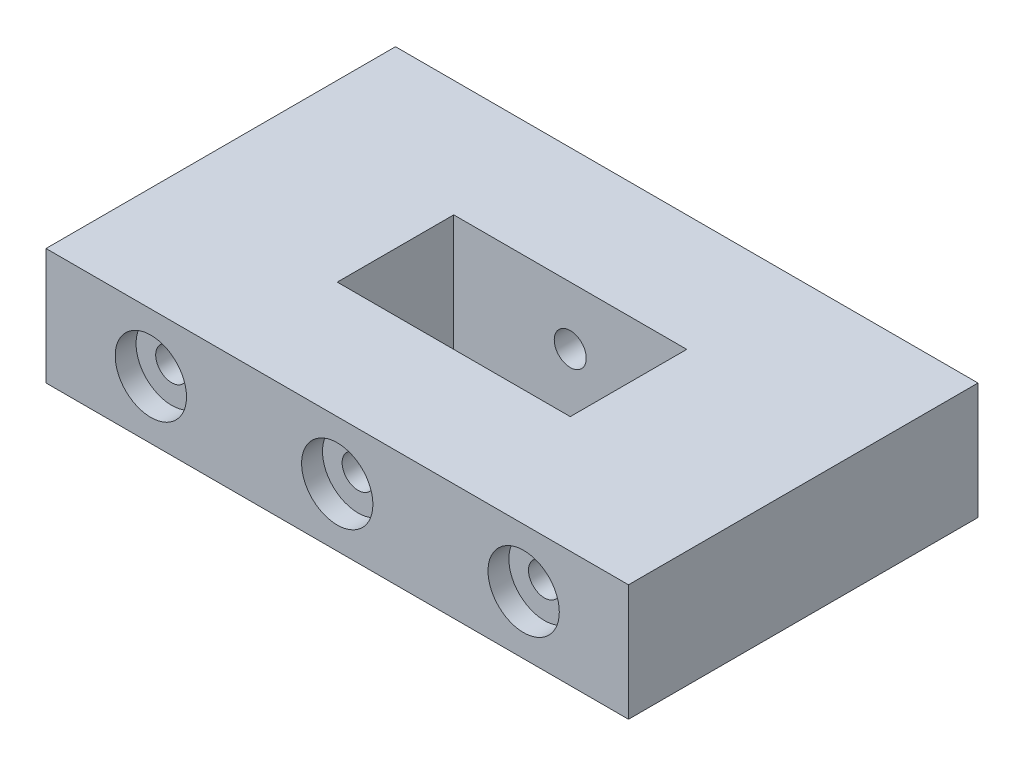
from build123d import *
from build123d.topology import SkipClean

# Parameters (mm, degrees)
SKETCH1_W                               = 100
SKETCH1_H                               = 60
BOSS_EXTRUDE1_DEPTH                     = 20
SKETCH2_W                               = 40
SKETCH2_H                               = 20
CUT_EXTRUDE1_DEPTH                      = 62.64414003
CBORE_FOR_M5_HEX_HEAD_BOLT1_D           = 5.5
CBORE_FOR_M5_HEX_HEAD_BOLT1_DEPTH       = 15
CBORE_FOR_M5_HEX_HEAD_BOLT1_CBORE_D     = 12.24
CBORE_FOR_M5_HEX_HEAD_BOLT1_CBORE_DEPTH = 3.58
CBORE_FOR_M5_HEX_HEAD_BOLT1_TIP         = 1.652366702
CBORE_FOR_M5_HEX_HEAD_BOLT2_D           = 5.5
CBORE_FOR_M5_HEX_HEAD_BOLT2_DEPTH       = 20
CBORE_FOR_M5_HEX_HEAD_BOLT2_CBORE_D     = 12.24
CBORE_FOR_M5_HEX_HEAD_BOLT2_CBORE_DEPTH = 3.58
CBORE_FOR_M5_HEX_HEAD_BOLT2_TIP         = 1.652366702
SHELL1_START                            = -48.6
SHELL1_2_OUTLINE_W                      = 17.2
SHELL1_2_OUTLINE_H                      = 17.2
SHELL1_2_DEPTH                          = 97.2
SHELL1_3_OUTLINE_W                      = 17.2
SHELL1_3_OUTLINE_H                      = 22.8
SHELL1_3_DEPTH                          = 27.2
SHELL1_START_2                          = 21.4
SHELL1_4_OUTLINE_W                      = 17.2
SHELL1_4_OUTLINE_H                      = 22.8
SHELL1_4_DEPTH                          = 27.2
SHELL1_START_3                          = -28.6
SHELL1_5_OUTLINE_R                      = 7.52
SHELL1_5_OUTLINE_R_2                    = 6.12
SHELL1_5_DEPTH                          = 3.58
SHELL1_START_4                          = -26.42
SHELL1_6_OUTLINE_R                      = 4.15
SHELL1_6_OUTLINE_R_2                    = 2.75
SHELL1_6_DEPTH                          = 15.02
SHELL1_7_OUTLINE_R                      = 6.12
SHELL1_7_OUTLINE_R_2                    = 4.15
SHELL1_7_DEPTH                          = 1.4


with BuildPart() as part:
    # Sketch1 → Boss-Extrude1 (new body)
    with BuildSketch(Plane(origin=(0, 0, 0), x_dir=(1, 0, 0), z_dir=(0, 1, 0))):
        Rectangle(SKETCH1_W, SKETCH1_H)
    extrude(amount=BOSS_EXTRUDE1_DEPTH)

    # Sketch2 → Cut-Extrude1 (cut, through all)
    with BuildSketch(Plane(origin=(0, 20, 0), x_dir=(1, 0, 0), z_dir=(0, 1, 0))):
        Rectangle(SKETCH2_W, SKETCH2_H)
    extrude(amount=-CUT_EXTRUDE1_DEPTH, mode=Mode.SUBTRACT)

    # CBORE for M5 Hex Head Bolt1
    with Locations(Plane.XY.offset(30)):
        with Locations((0, 10), (-32, 10), (32, 10)):
            CounterBoreHole(CBORE_FOR_M5_HEX_HEAD_BOLT1_D / 2, CBORE_FOR_M5_HEX_HEAD_BOLT1_CBORE_D / 2, CBORE_FOR_M5_HEX_HEAD_BOLT1_CBORE_DEPTH, depth=CBORE_FOR_M5_HEX_HEAD_BOLT1_DEPTH)
            with Locations((0, 0, -(CBORE_FOR_M5_HEX_HEAD_BOLT1_DEPTH + CBORE_FOR_M5_HEX_HEAD_BOLT1_TIP / 2))):  # 118° drill point
                Cone(0, CBORE_FOR_M5_HEX_HEAD_BOLT1_D / 2, CBORE_FOR_M5_HEX_HEAD_BOLT1_TIP, mode=Mode.SUBTRACT)

    # CBORE for M5 Hex Head Bolt2
    with Locations(Plane(origin=(0, 0, -30), x_dir=(-1, 0, 0), z_dir=(0, 0, -1))):
        with Locations((0, 10.04768743), (-31.999964467, 10), (31.999964467, 10)):
            CounterBoreHole(CBORE_FOR_M5_HEX_HEAD_BOLT2_D / 2, CBORE_FOR_M5_HEX_HEAD_BOLT2_CBORE_D / 2, CBORE_FOR_M5_HEX_HEAD_BOLT2_CBORE_DEPTH, depth=CBORE_FOR_M5_HEX_HEAD_BOLT2_DEPTH)
            with Locations((0, 0, -(CBORE_FOR_M5_HEX_HEAD_BOLT2_DEPTH + CBORE_FOR_M5_HEX_HEAD_BOLT2_TIP / 2))):  # 118° drill point
                Cone(0, CBORE_FOR_M5_HEX_HEAD_BOLT2_D / 2, CBORE_FOR_M5_HEX_HEAD_BOLT2_TIP, mode=Mode.SUBTRACT)

    # Shell1: read off the stored shape, not the designer's step
    # Shell1 outline → Shell1 (revolve, cut)
    with BuildSketch(Plane(origin=(-32, 10, 0), x_dir=(1, 0, 0), z_dir=(0, -1, 0))):
        Polygon((4.15, 14.207918111), (0, 11.714346542), (7.52, 11.714346542), (7.52, 25.02), (4.15, 25.02), align=None)
    revolve(axis=Axis((-32, 10, 0), (0, 0, 1)), mode=Mode.SUBTRACT)

    # Shell1 2 outline → Shell1 2 (cut)
    with BuildSketch(Plane.YZ.offset(SHELL1_START)):
        with Locations((10, -20)):
            Rectangle(SHELL1_2_OUTLINE_W, SHELL1_2_OUTLINE_H)
        with Locations((10, 20)):
            Rectangle(SHELL1_2_OUTLINE_W, SHELL1_2_OUTLINE_H)
    extrude(amount=SHELL1_2_DEPTH, mode=Mode.SUBTRACT)

    # Shell1 3 outline → Shell1 3 (cut)
    with BuildSketch(Plane.YZ.offset(SHELL1_START)):
        with Locations((10, 0)):
            Rectangle(SHELL1_3_OUTLINE_W, SHELL1_3_OUTLINE_H)
    extrude(amount=SHELL1_3_DEPTH, mode=Mode.SUBTRACT)

    # Shell1 4 outline → Shell1 4 (cut)
    with BuildSketch(Plane.YZ.offset(SHELL1_START_2)):
        with Locations((10, 0)):
            Rectangle(SHELL1_4_OUTLINE_W, SHELL1_4_OUTLINE_H)
    extrude(amount=SHELL1_4_DEPTH, mode=Mode.SUBTRACT)

    # Shell1 5 outline → Shell1 5 (add)
    # profile 1 of 3: a face of its own
    with SkipClean():  # the faces are left unmerged after this step: merging them gives an invalid solid
        with BuildSketch(Plane.XY.offset(SHELL1_START_3)):
            with Locations((0, 10.04768743)):
                Circle(SHELL1_5_OUTLINE_R)
            with Locations((0, 10.04768743)):
                Circle(SHELL1_5_OUTLINE_R_2, mode=Mode.SUBTRACT)
        # profile 2 of 3: a face of its own
        with BuildSketch(Plane.XY.offset(SHELL1_START_3)):
            with Locations((-31.999964467, 10)):
                Circle(SHELL1_5_OUTLINE_R)
            with Locations((-31.999964467, 10)):
                Circle(SHELL1_5_OUTLINE_R_2, mode=Mode.SUBTRACT)
        # profile 3 of 3: a face of its own
        with BuildSketch(Plane.XY.offset(SHELL1_START_3)):
            with Locations((31.999964467, 10)):
                Circle(SHELL1_5_OUTLINE_R)
            with Locations((31.999964467, 10)):
                Circle(SHELL1_5_OUTLINE_R_2, mode=Mode.SUBTRACT)
        extrude(amount=SHELL1_5_DEPTH)
    add(part.part.scale(1), mode=Mode.REPLACE)  # the faces are merged on a copy

    # Shell1 6 outline → Shell1 6 (add)
    with BuildSketch(Plane.XY.offset(SHELL1_START_4)):
        with Locations((0, 10.04768743)):
            Circle(SHELL1_6_OUTLINE_R)
        with Locations((0, 10.04768743)):
            Circle(SHELL1_6_OUTLINE_R_2, mode=Mode.SUBTRACT)
    extrude(amount=SHELL1_6_DEPTH)

    # Shell1 7 outline → Shell1 7 (add)
    with SkipClean():  # the faces are left unmerged after this step: merging them gives an invalid solid
        with BuildSketch(Plane.XY.offset(SHELL1_START_4)):
            with Locations((0, 10.04768743)):
                Circle(SHELL1_7_OUTLINE_R)
            with Locations((0, 10.04768743)):
                Circle(SHELL1_7_OUTLINE_R_2, mode=Mode.SUBTRACT)
        extrude(amount=SHELL1_7_DEPTH)

    # Shell1 8 outline → Shell1 8 (revolve)
    with SkipClean():  # the faces are left unmerged after this step: merging them gives an invalid solid
        with BuildSketch(Plane(origin=(32, 10, 0), x_dir=(1, 0, 0), z_dir=(0, -1, 0))):
            Polygon((0, 11.714346542), (4.15, 14.207918111), (4.15, 25.02), (7.52, 25.02), (7.52, 28.6), (6.12, 28.6), (6.12, 26.42), (2.75, 26.42), (2.75, 15), (0, 13.347633298), align=None)
        revolve(axis=Axis((32, 10, 0), (0, 0, 1)))

    # Shell1 9 outline → Shell1 9 (revolve)
    with SkipClean():  # the faces are left unmerged after this step: merging them gives an invalid solid
        with BuildSketch(Plane(origin=(-32, 10, 0), x_dir=(1, 0, 0), z_dir=(0, -1, 0))):
            Polygon((2.75, 26.42), (2.75, 15), (0, 13.347633298), (0, 11.714346542), (4.15, 14.207918111), (4.15, 25.02), (7.52, 25.02), (7.52, 28.6), (6.12, 28.6), (6.12, 26.42), align=None)
        revolve(axis=Axis((-32, 10, 0), (0, 0, 1)))

    # Shell1 10 outline → Shell1 10 (revolve)
    with SkipClean():  # the faces are left unmerged after this step: merging them gives an invalid solid
        with BuildSketch(Plane.XZ.offset(-10)):
            Polygon((2.75, 26.42), (2.75, 15), (0, 13.347633298), (0, 11.714346542), (4.15, 14.207918111), (4.15, 25.02), (7.52, 25.02), (7.52, 28.6), (6.12, 28.6), (6.12, 26.42), align=None)
        revolve(axis=Axis((0, 10, 0), (0, 0, 1)))

    # Shell1 11 outline → Shell1 11 (revolve)
    with BuildSketch(Plane(origin=(-31.999964467, 10, 0), x_dir=(1, 0, 0), z_dir=(0, -1, 0))):
        Polygon((0, -6.714346542), (0, -8.347633298), (2.75, -10), (2.75, -26.42), (6.12, -26.42), (6.12, -28.6), (7.52, -28.6), (7.52, -25.02), (4.15, -25.02), (4.15, -9.207918111), align=None)
    revolve(axis=Axis((-31.999964467, 10, 0), (0, 0, 1)))

    # Shell1 12 outline → Shell1 12 (revolve)
    with BuildSketch(Plane(origin=(31.999964467, 10, 0), x_dir=(1, 0, 0), z_dir=(0, -1, 0))):
        Polygon((2.75, -10), (2.75, -26.42), (6.12, -26.42), (6.12, -28.6), (7.52, -28.6), (7.52, -25.02), (4.15, -25.02), (4.15, -9.207918111), (0, -6.714346542), (0, -8.347633298), align=None)
    revolve(axis=Axis((31.999964467, 10, 0), (0, 0, 1)))


solid = part.part
